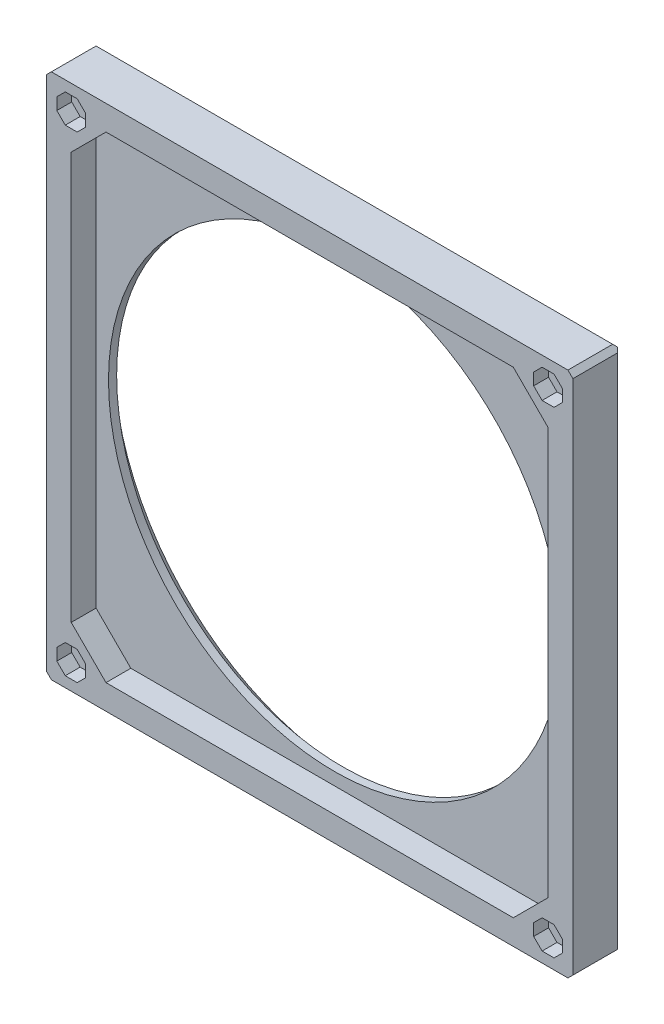
from build123d import *

# Parameters (mm, degrees)
SKETCH1_LARGER_DIA_W  = 106
SKETCH1_LARGER_DIA_H  = 106
BOSS_EXTRUDE1_DEPTH   = 5
SKETCH5_SMALLER_DIA_W = 106
SKETCH5_SMALLER_DIA_H = 106
SKETCH5_SMALLER_DIA_R = 45.5
BOSS_EXTRUDE2_DEPTH   = 5
CUT_EXTRUDE1_DEPTH    = 3
CHAMFER1_SIZE         = 4
CHAMFER1_SIZE2        = 3.356398525
CHAMFER2_SIZE         = 1
CHAMFER3_SIZE         = 1


with BuildPart() as part:
    # Sketch1 larger dia → Boss-Extrude1 (new body)
    with BuildSketch(Plane.XY):
        Rectangle(SKETCH1_LARGER_DIA_W, SKETCH1_LARGER_DIA_H)
        Polygon((-41, 48), (41, 48), (48, 41), (48, -41), (41, -48), (-41, -48), (-48, -41), (-48, 41), align=None, mode=Mode.SUBTRACT)
    extrude(amount=BOSS_EXTRUDE1_DEPTH)

    # Sketch5 smaller dia → Boss-Extrude2 (add)
    with BuildSketch(Plane(origin=(0, 0, 0), x_dir=(-1, 0, 0), z_dir=(0, 0, -1))):
        Rectangle(SKETCH5_SMALLER_DIA_W, SKETCH5_SMALLER_DIA_H)
        Circle(SKETCH5_SMALLER_DIA_R, mode=Mode.SUBTRACT)
    extrude(amount=BOSS_EXTRUDE2_DEPTH)

    # Sketch1 → Cut-Extrude1 (cut)
    with BuildSketch(Plane.XY.offset(5)):
        Polygon((-45.1, 46.798780669), (-45.1, 49.201219331), (-46.798780669, 50.9), (-49.201219331, 50.9), (-50.9, 49.201219331), (-50.9, 46.798780669), (-49.201219331, 45.1), (-46.798780669, 45.1), align=None)
        Polygon((-46.798780669, -45.1), (-45.1, -46.798780669), (-45.1, -49.201219331), (-46.798780669, -50.9), (-49.201219331, -50.9), (-50.9, -49.201219331), (-50.9, -46.798780669), (-49.201219331, -45.1), align=None)
        Polygon((46.798780669, 45.1), (45.1, 46.798780669), (45.1, 49.201219331), (46.798780669, 50.9), (49.201219331, 50.9), (50.9, 49.201219331), (50.9, 46.798780669), (49.201219331, 45.1), align=None)
        Polygon((45.1, -46.798780669), (45.1, -49.201219331), (46.798780669, -50.9), (49.201219331, -50.9), (50.9, -49.201219331), (50.9, -46.798780669), (49.201219331, -45.1), (46.798780669, -45.1), align=None)
    extrude(amount=-CUT_EXTRUDE1_DEPTH, mode=Mode.SUBTRACT)

    # Chamfer1
    chamfer1_edges = [part.edges().sort_by_distance(p)[0] for p in [
        (45.5, 0, -5),
    ]]
    chamfer1_side = [part.faces().sort_by_distance(p)[0] for p in [
        (0, 51.500933624, -5),
    ]]
    chamfer(chamfer1_edges, length=CHAMFER1_SIZE, length2=CHAMFER1_SIZE2, reference=chamfer1_side[0])

    # Chamfer2
    chamfer2_edges = [part.edges().sort_by_distance(p)[0] for p in [
        (0, -53, -5),
        (53, 0, -5),
        (0, 53, -5),
        (-53, 0, -5),
    ]]
    chamfer(chamfer2_edges, length=CHAMFER2_SIZE)

    # Chamfer3
    chamfer3_edges = [part.edges().sort_by_distance(p)[0] for p in [
        (53, -53, 0.5),
        (-53, -53, 0.5),
        (-53, 53, 0.5),
        (53, 53, 0.5),
    ]]
    chamfer(chamfer3_edges, length=CHAMFER3_SIZE)


solid = part.part
